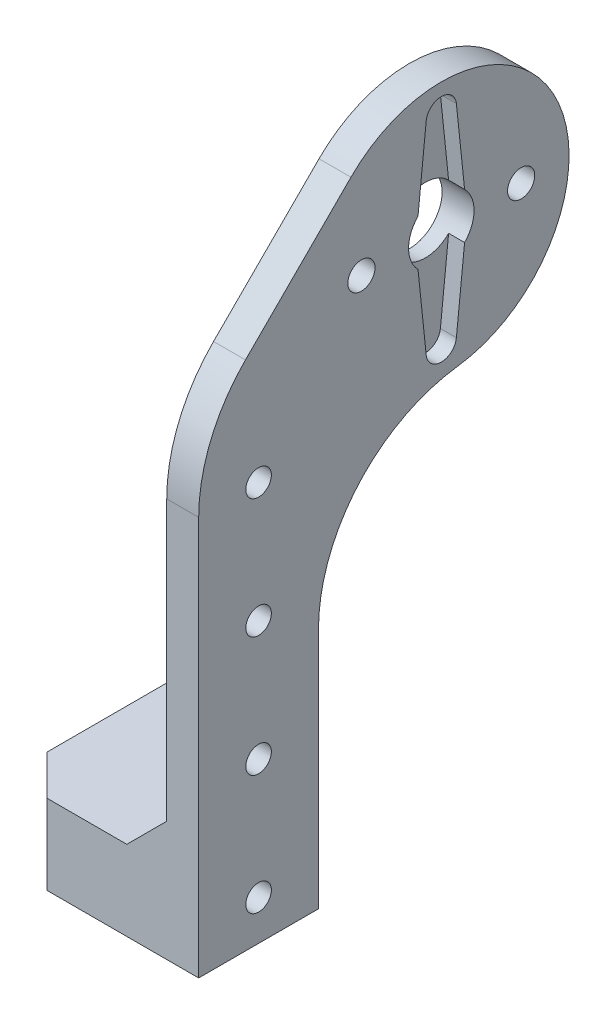
from build123d import *

# Parameters (mm, degrees)
SKETCH1_R                                           = 16
BOSS_EXTRUDE1_DEPTH                                 = 4
CUT_EXTRUDE2_DEPTH                                  = 2
SKETCH3_R                                           = 4.1
CUT_EXTRUDE1_DEPTH                                  = 23.978250586
CSK_FOR_M3_COUNTERSUNK_FLAT_HEAD_SCREW1_D           = 3.4
CSK_FOR_M3_COUNTERSUNK_FLAT_HEAD_SCREW1_CSINK_D     = 6.3
CSK_FOR_M3_COUNTERSUNK_FLAT_HEAD_SCREW1_CSINK_ANGLE = 90
BOSS_EXTRUDE3_DEPTH                                 = 4
FILLET3_R                                           = 20
BOSS_EXTRUDE4_DEPTH                                 = 10
CHAMFER1_SIZE                                       = 5
CUT_EXTRUDE5_DEPTH                                  = 74.993512369
SKETCH10_R                                          = 1.6
CUT_EXTRUDE4_DEPTH                                  = 77.518232271


with BuildPart() as part:
    # Sketch1 → Boss-Extrude1 (new body)
    with BuildSketch(Plane(origin=(0, 0, 0), x_dir=(0, 0, -1), z_dir=(1, 0, 0))):
        Circle(SKETCH1_R)
    extrude(amount=BOSS_EXTRUDE1_DEPTH)

    # Sketch5 → Cut-Extrude2 (cut)
    with BuildSketch(Plane(origin=(4, 0, 0), x_dir=(0, 0, -1), z_dir=(1, 0, 0))):
        with BuildLine():
            Line((-1.889696865, 12.6976), (-2.933047351, 2.719785513))
            ThreePointArc((-2.933047351, 2.719785513), (-4, 0), (-2.933047351, -2.719785513))
            Line((-2.933047351, -2.719785513), (-1.889696865, -12.6976))
            ThreePointArc((-1.889696865, -12.6976), (0, -14.4), (1.889696865, -12.6976))
            Line((1.889696865, -12.6976), (2.933047351, -2.719785513))
            ThreePointArc((2.933047351, -2.719785513), (4, 0), (2.933047351, 2.719785513))
            Line((2.933047351, 2.719785513), (1.889696865, 12.6976))
            ThreePointArc((1.889696865, 12.6976), (0, 14.4), (-1.889696865, 12.6976))
        make_face()
    extrude(amount=-CUT_EXTRUDE2_DEPTH, mode=Mode.SUBTRACT)

    # Sketch3 → Cut-Extrude1 (cut, through all)
    with BuildSketch(Plane(origin=(4, 0, 0), x_dir=(0, 0, -1), z_dir=(1, 0, 0))):
        Circle(SKETCH3_R)
    extrude(amount=-CUT_EXTRUDE1_DEPTH, mode=Mode.SUBTRACT)

    # CSK for M3 Countersunk Flat Head Screw1 (through all)
    with Locations(Plane.ZY):
        with Locations((-10, 0), (10, 0)):
            CounterSinkHole(CSK_FOR_M3_COUNTERSUNK_FLAT_HEAD_SCREW1_D / 2, CSK_FOR_M3_COUNTERSUNK_FLAT_HEAD_SCREW1_CSINK_D / 2, counter_sink_angle=CSK_FOR_M3_COUNTERSUNK_FLAT_HEAD_SCREW1_CSINK_ANGLE)

    # Sketch9 → Boss-Extrude3 (add)
    with BuildSketch(Plane(origin=(0, 0, 0), x_dir=(0, 0, -1), z_dir=(1, 0, 0))):
        with BuildLine():
            Line((-30.381570905, -7.754153907), (-30.381570905, -66))
            Line((-30.381570905, -66), (-15.381570905, -66))
            Line((-15.381570905, -66), (-15.381570905, -16))
            Line((-15.381570905, -16), (0, -16))
            ThreePointArc((0, -16), (-14.78207252, -6.122934918), (-11.313708499, 11.313708499))
            Line((-11.313708499, 11.313708499), (-30.381570905, -7.754153907))
        make_face()
    extrude(amount=BOSS_EXTRUDE3_DEPTH)

    # Fillet3
    fillet3_edges = [part.edges().sort_by_distance(p)[0] for p in [
        (2, -7.754153907, 30.381570905),
        (2, -16, 15.381570905),
    ]]
    fillet(fillet3_edges, radius=FILLET3_R)

    # Sketch11 → Boss-Extrude4 (add)
    with BuildSketch(Plane.XZ.offset(66)):
        Polygon((0, 15.381570905), (-10, 15.381570905), (-10, 0), (-20, 0), (-20, 30.381570905), (0, 30.381570905), align=None)
    extrude(amount=-BOSS_EXTRUDE4_DEPTH)

    # Chamfer1
    chamfer1_edges = [part.edges().sort_by_distance(p)[0] for p in [
        (-10, -61, 15.381570905),
        (-20, -61, 30.381570905),
        (0, -56, 22.881570905),
    ]]
    chamfer(chamfer1_edges, length=CHAMFER1_SIZE - 0.0001)  # a hair under: the kernel refuses the full size

    # Sketch12 → Cut-Extrude5 (cut, through all)
    with BuildSketch(Plane(origin=(-10, 0, 0), x_dir=(0, 0, -1), z_dir=(1, 0, 0))):
        Polygon((-6.955897301, -66), (-3.316194958, -56), (0, -56), (0, -66), align=None)
    extrude(amount=-CUT_EXTRUDE5_DEPTH, mode=Mode.SUBTRACT)

    # Sketch10 → Cut-Extrude4 (cut, through all)
    with BuildSketch(Plane(origin=(4, 0, 0), x_dir=(0, 0, -1), z_dir=(1, 0, 0))):
        with Locations((-22.881570905, -16)):
            Circle(SKETCH10_R)
        with Locations((-22.881570905, -31)):
            Circle(SKETCH10_R)
        with Locations((-22.881570905, -46)):
            Circle(SKETCH10_R)
        with Locations((-22.881570905, -61)):
            Circle(SKETCH10_R)
    extrude(amount=-CUT_EXTRUDE4_DEPTH, mode=Mode.SUBTRACT)


solid = part.part
